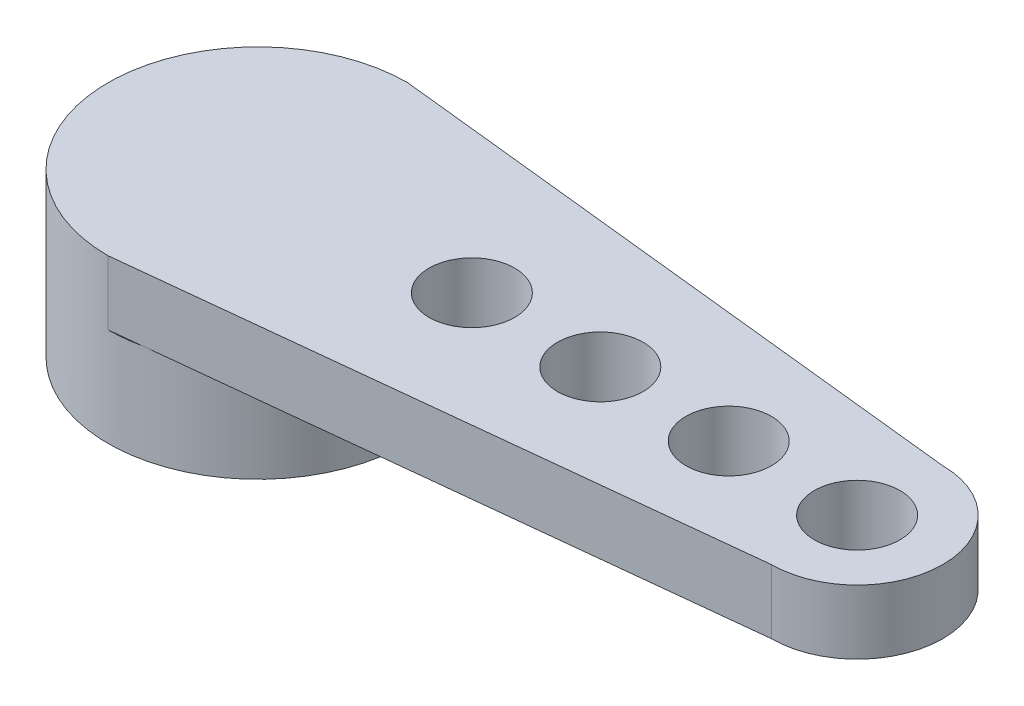
from build123d import *

# Parameters (mm, degrees)
BOSS_EXTRUDE1_DEPTH = 1.5
BOSS_EXTRUDE2_START = 2.3
SKETCH2_R           = 3.5
SKETCH2_R_2         = 2.4
BOSS_EXTRUDE2_DEPTH = 2.3
SKETCH3_R           = 1
CUT_EXTRUDE2_DEPTH  = 17.813387523


with BuildPart() as part:
    # Sketch1 → Boss-Extrude1 (new body)
    with BuildSketch(Plane(origin=(0, 0, 0), x_dir=(1, 0, 0), z_dir=(0, 1, 0))):
        with BuildLine():
            Line((0, 3.5), (14, 2))
            ThreePointArc((14, 2), (16, 0), (14, -2))
            Line((14, -2), (0, -3.5))
            ThreePointArc((0, -3.5), (-3.5, 0), (0, 3.5))
        make_face()
    extrude(amount=BOSS_EXTRUDE1_DEPTH)

    # Sketch2 → Boss-Extrude2 (add)
    with BuildSketch(Plane.XZ.offset(BOSS_EXTRUDE2_START)):
        Circle(SKETCH2_R)
        Circle(SKETCH2_R_2, mode=Mode.SUBTRACT)
    extrude(amount=-BOSS_EXTRUDE2_DEPTH)

    # Sketch3 → Cut-Extrude2 (cut, through all)
    with BuildSketch(Plane(origin=(0, 1.5, 0), x_dir=(1, 0, 0), z_dir=(0, 1, 0))):
        with Locations((14, 0)):
            Circle(SKETCH3_R)
        with Locations((11, 0)):
            Circle(SKETCH3_R)
        with Locations((8, 0)):
            Circle(SKETCH3_R)
        with Locations((5, 0)):
            Circle(SKETCH3_R)
    extrude(amount=-CUT_EXTRUDE2_DEPTH, mode=Mode.SUBTRACT)


solid = part.part
